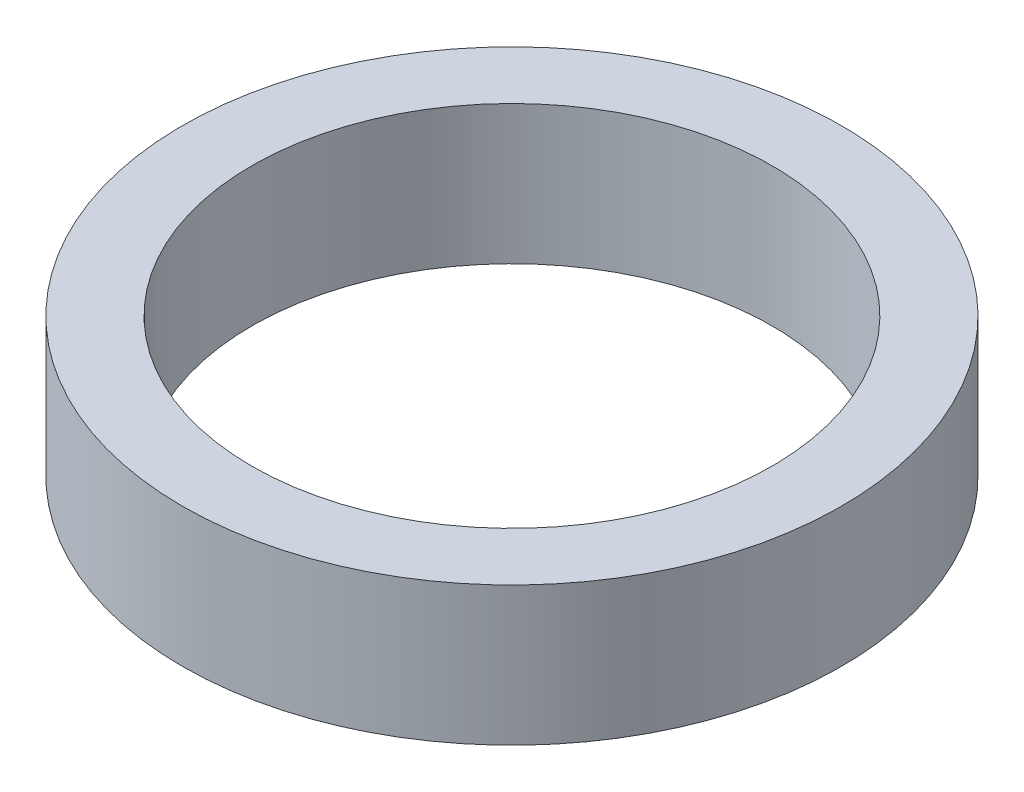
from build123d import *

# Parameters (mm, degrees)
SKETCH1_R           = 47.5
BOSS_EXTRUDE1_DEPTH = 20
SKETCH2_R           = 37.5
CUT_EXTRUDE1_DEPTH  = 71.089228844


with BuildPart() as part:
    # Sketch1 → Boss-Extrude1 (new body)
    with BuildSketch(Plane(origin=(0, 0, 0), x_dir=(1, 0, 0), z_dir=(0, 1, 0))):
        Circle(SKETCH1_R)
    extrude(amount=BOSS_EXTRUDE1_DEPTH)

    # Sketch2 → Cut-Extrude1 (cut, through all)
    with BuildSketch(Plane(origin=(0, 0, 0), x_dir=(1, 0, 0), z_dir=(0, 1, 0))):
        Circle(SKETCH2_R)
    extrude(amount=CUT_EXTRUDE1_DEPTH, mode=Mode.SUBTRACT)


solid = part.part
